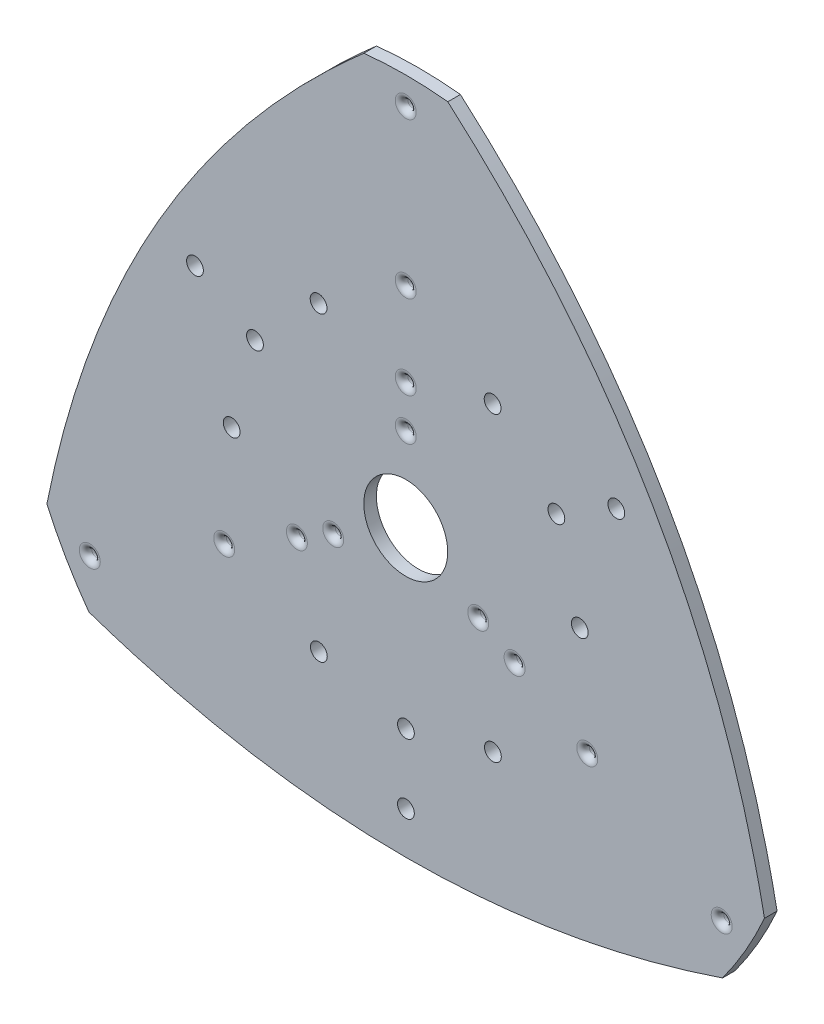
from build123d import *

# Parameters (mm, degrees)
SKETCH_1_R      = 1
SKETCH_1_R_2    = 2
EXTRUDE_1_DEPTH = 3
FILLET_1_R      = 1.5


with BuildPart() as part:
    # 草图1 → 凸台-拉伸1 (new body)
    with BuildSketch(Plane.XY):
        with BuildLine():
            add(Edge.make_bspline(
                [(-58.889727457, 33.954361717), (-40.004533189, 66.652425342), (-9.985691385, 92.919602359)],
                knots=[0.499900516, 0.499900516, 0.499900516, 1, 1, 1], degree=2))
            add(Edge.make_bspline(
                [(-85.520298702, -37.841517818), (-77.767408146, 1.269307198), (-58.889727457, 33.954361717)],
                knots=[0, 0, 0, 0.499900516, 0.499900516, 0.499900516], degree=2))
            ThreePointArc((-85.520298702, -37.841517818), (-80.984000735, -46.777229577), (-75.517414372, -55.176121017))
            add(Edge.make_bspline(
                [(75.492341187, -55.21044973), (-0.017509419, -80.897985379), (-75.517414372, -55.176121017)],
                knots=[0, 0, 0, 1, 1, 1], degree=2))
            ThreePointArc((75.492341187, -55.21044973), (80.962745588, -46.814044572), (85.503105757, -37.88039619))
            add(Edge.make_bspline(
                [(10.027957515, 92.915052701), (70.02894125, 40.365371664), (85.503105757, -37.88039619)],
                knots=[0, 0, 0, 1, 1, 1], degree=2))
            ThreePointArc((10.027957515, 92.915052701), (0.021255147, 93.454359301), (-9.985691385, 92.919602359))
        make_face()
        with Locations((-75.304686217, -43.477180859)):
            Circle(SKETCH_1_R, mode=Mode.SUBTRACT)
        with Locations((-43.261746277, -24.977180859)):
            Circle(SKETCH_1_R, mode=Mode.SUBTRACT)
        with Locations((-20.704361717, -35.940054257)):
            Circle(SKETCH_1_R_2, mode=Mode.SUBTRACT)
        with Locations((-41.477180859, -0.039523912)):
            Circle(SKETCH_1_R_2, mode=Mode.SUBTRACT)
        with Locations((-25.941238201, -14.977180859)):
            Circle(SKETCH_1_R, mode=Mode.SUBTRACT)
        with Locations((-17.280984164, -9.977180859)):
            Circle(SKETCH_1_R, mode=Mode.SUBTRACT)
        with BuildLine():
            ThreePointArc((-10, -0.045638283), (-9.659258263, 2.542552168), (-8.660254038, 4.954361717))
            ThreePointArc((-8.660254038, 4.954361717), (9.659258263, -2.633828734), (-10, -0.045638283))
        make_face(mode=Mode.SUBTRACT)
        with Locations((0.039523912, -57.977180859)):
            Circle(SKETCH_1_R_2, mode=Mode.SUBTRACT)
        with Locations((0.039523912, -41.477180859)):
            Circle(SKETCH_1_R_2, mode=Mode.SUBTRACT)
        with Locations((20.772819141, -35.900530345)):
            Circle(SKETCH_1_R_2, mode=Mode.SUBTRACT)
        with Locations((75.304686217, -43.477180859)):
            Circle(SKETCH_1_R, mode=Mode.SUBTRACT)
        with Locations((43.261746277, -24.977180859)):
            Circle(SKETCH_1_R, mode=Mode.SUBTRACT)
        with Locations((17.280984164, -9.977180859)):
            Circle(SKETCH_1_R, mode=Mode.SUBTRACT)
        with Locations((25.941238201, -14.977180859)):
            Circle(SKETCH_1_R, mode=Mode.SUBTRACT)
        with Locations((41.477180859, 0.039523912)):
            Circle(SKETCH_1_R_2, mode=Mode.SUBTRACT)
        with BuildLine():
            ThreePointArc((-48.497422612, 27.954361717), (-51.229473419, 27.22231091), (-51.961524227, 29.954361717))
            ThreePointArc((-51.961524227, 29.954361717), (-49.229473419, 30.686412525), (-48.497422612, 27.954361717))
        make_face(mode=Mode.SUBTRACT)
        with BuildLine():
            ThreePointArc((-34.208003449, 19.704361717), (-36.940054257, 18.97231091), (-37.672105065, 21.704361717))
            ThreePointArc((-37.672105065, 21.704361717), (-34.940054257, 22.436412525), (-34.208003449, 19.704361717))
        make_face(mode=Mode.SUBTRACT)
        with Locations((0, 19.954361717)):
            Circle(SKETCH_1_R, mode=Mode.SUBTRACT)
        with Locations((0, 29.954361717)):
            Circle(SKETCH_1_R, mode=Mode.SUBTRACT)
        with Locations((-20.772819141, 35.900530345)):
            Circle(SKETCH_1_R_2, mode=Mode.SUBTRACT)
        with Locations((0, 49.954361717)):
            Circle(SKETCH_1_R, mode=Mode.SUBTRACT)
        with Locations((0, 86.954361717)):
            Circle(SKETCH_1_R, mode=Mode.SUBTRACT)
        with Locations((35.900530345, 20.772819141)):
            Circle(SKETCH_1_R_2, mode=Mode.SUBTRACT)
        with Locations((20.704361717, 35.940054257)):
            Circle(SKETCH_1_R_2, mode=Mode.SUBTRACT)
        with Locations((50.189949507, 29.022819141)):
            Circle(SKETCH_1_R_2, mode=Mode.SUBTRACT)
    extrude(amount=EXTRUDE_1_DEPTH)

    # 圆角1
    fillet_1_edges = [part.edges().sort_by_distance(p)[0] for p in [
        (-1, 86.954361717, 3),
        (-1, 49.954361717, 3),
        (-1, 29.954361717, 3),
        (-1, 19.954361717, 3),
        (74.304686217, -43.477180859, 3),
        (42.261746277, -24.977180859, 3),
        (24.941238201, -14.977180859, 3),
        (16.280984164, -9.977180859, 3),
        (-76.304686217, -43.477180859, 3),
        (-44.261746277, -24.977180859, 3),
        (-26.941238201, -14.977180859, 3),
        (-18.280984164, -9.977180859, 3),
        (-18.280984164, -9.977180859, 0),
        (-26.941238201, -14.977180859, 0),
        (-44.261746277, -24.977180859, 0),
        (-76.304686217, -43.477180859, 0),
        (16.280984164, -9.977180859, 0),
        (24.941238201, -14.977180859, 0),
        (42.261746277, -24.977180859, 0),
        (74.304686217, -43.477180859, 0),
        (-1, 19.954361717, 0),
        (-1, 29.954361717, 0),
        (-1, 49.954361717, 0),
        (-1, 86.954361717, 0),
    ]]
    fillet(fillet_1_edges, radius=FILLET_1_R - 0.0001)  # a hair under: the kernel refuses the full size


solid = part.part
